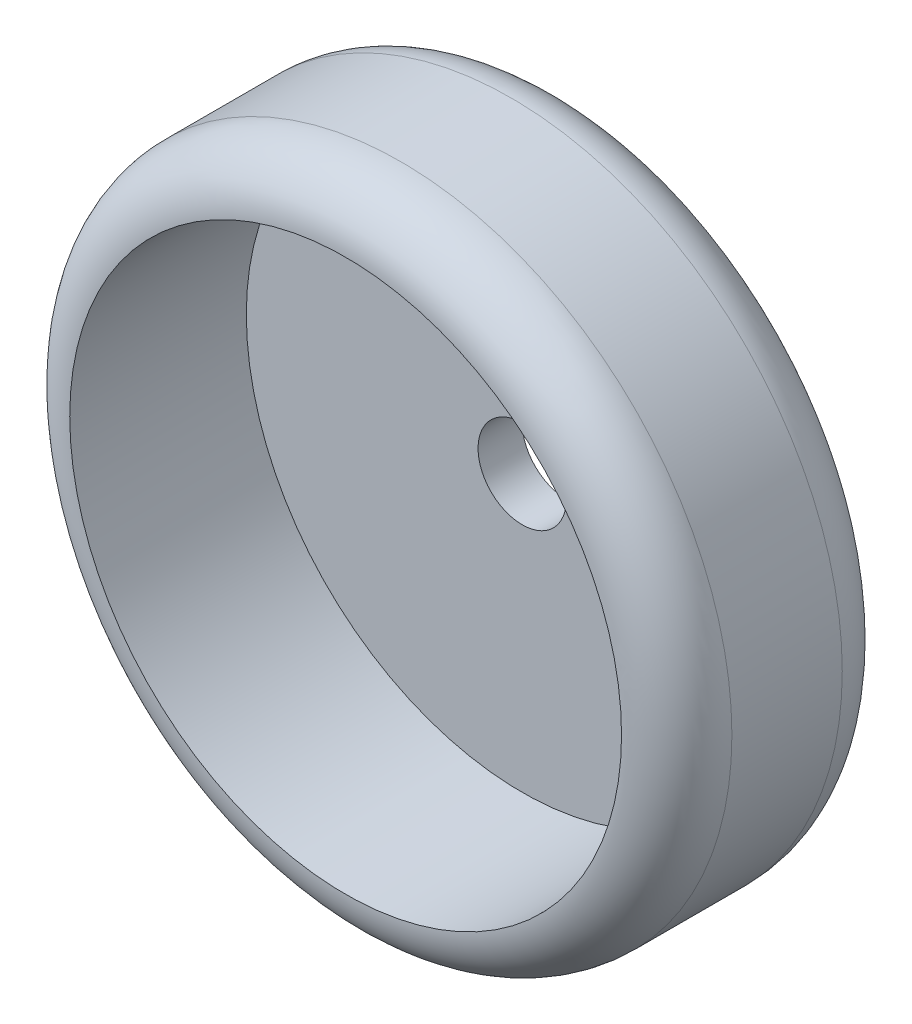
from build123d import *

# Parameters (mm, degrees)
SKETCH_1_R          = 30
SKETCH_1_R_2        = 4
EXTRUDE_1_DEPTH     = 20
SKETCH_2_R          = 25
CUT_EXTRUDE_1_DEPTH = 16
FILLET_1_R          = 5


with BuildPart() as part:
    # 草图1 → 凸台-拉伸1 (new body)
    with BuildSketch(Plane.XY):
        Circle(SKETCH_1_R)
        Circle(SKETCH_1_R_2, mode=Mode.SUBTRACT)
    extrude(amount=EXTRUDE_1_DEPTH)

    # 草图2 → 切除-拉伸1 (cut)
    with BuildSketch(Plane.XY.offset(20)):
        Circle(SKETCH_2_R)
    extrude(amount=-CUT_EXTRUDE_1_DEPTH, mode=Mode.SUBTRACT)

    # 圆角1
    fillet_1_edges = [part.edges().sort_by_distance(p)[0] for p in [
        (-30, 0, 0),
        (-30, 0, 20),
    ]]
    fillet(fillet_1_edges, radius=FILLET_1_R - 0.0001)  # a hair under: the kernel refuses the full size


solid = part.part
